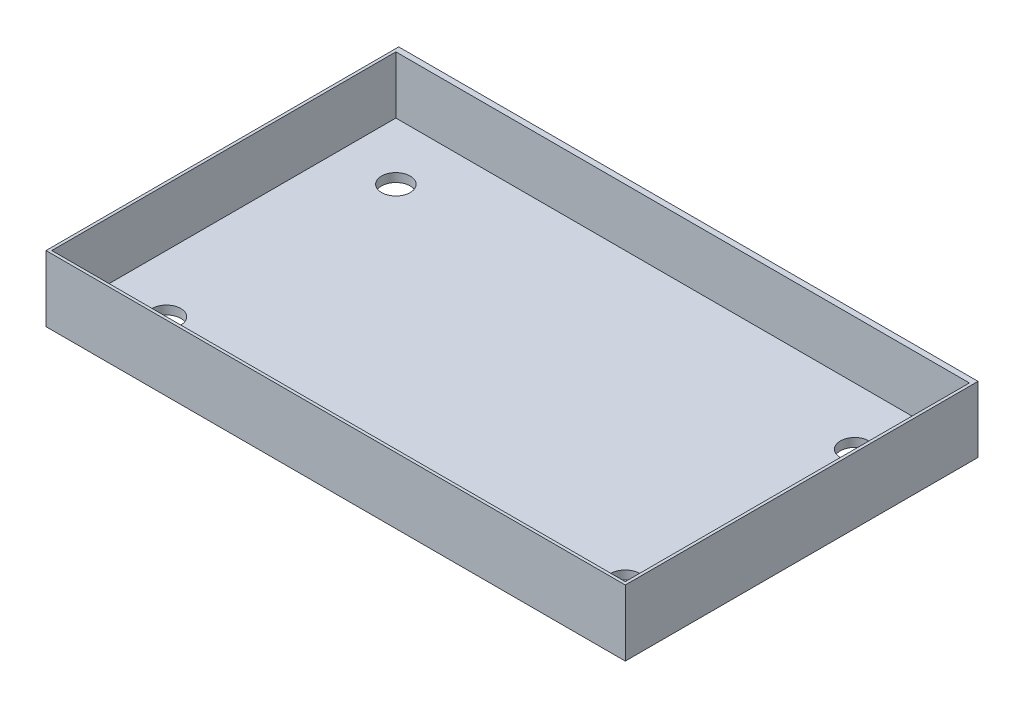
from build123d import *

# Parameters (mm, degrees)
SKETCH1_W             = 200
SKETCH1_H             = 120
BOSS_EXTRUDE3_DEPTH   = 3
SKETCH7_W             = 25
SKETCH7_H             = 120
BOSS_EXTRUDE4_DEPTH   = 1
SKETCH8_W             = 10
SKETCH8_H             = 5
BOSS_EXTRUDE5_DEPTH   = 2
BOSS_EXTRUDE5_2_DEPTH = 2
BOSS_EXTRUDE5_3_DEPTH = 2
BOSS_EXTRUDE5_4_DEPTH = 2
SKETCH10_W            = 10
SKETCH10_H            = 5
BOSS_EXTRUDE6_DEPTH   = 5
SKETCH11_R            = 5
CUT_EXTRUDE4_DEPTH    = 5
SKETCH13_W            = 6
SKETCH13_H            = 2
CUT_EXTRUDE5_DEPTH    = 130.77769454
FILLET3_R             = 1
FILLET4_R             = 1
SKETCH15_W            = 10
SKETCH15_H            = 5
BOSS_EXTRUDE9_DEPTH   = 7
SKETCH16_W            = 6
SKETCH16_H            = 2
CUT_EXTRUDE8_DEPTH    = 138.081180328
FILLET5_R             = 1
SKETCH18_W            = 120
SKETCH18_H            = 23
BOSS_EXTRUDE10_DEPTH  = 1
SKETCH19_W            = 202
SKETCH19_H            = 23
BOSS_EXTRUDE11_DEPTH  = 1
MIRROR2_START         = -62
MIRROR2_OUTLINE_W     = 202
MIRROR2_OUTLINE_H     = 23
MIRROR2_DEPTH         = 1
MIRROR2_START_2       = 60
MIRROR2_2_OUTLINE_W   = 202
MIRROR2_2_OUTLINE_H   = 23
MIRROR2_2_DEPTH       = 1


# Read off the part's stored shape, not the designer's step: Mirror2
with BuildPart() as part:
    # Sketch1 → Boss-Extrude3 (new body)
    with BuildSketch(Plane(origin=(0, 0, 0), x_dir=(1, 0, 0), z_dir=(0, 1, 0))):
        Rectangle(SKETCH1_W, SKETCH1_H)
    extrude(amount=BOSS_EXTRUDE3_DEPTH)

    # Sketch7 → Boss-Extrude4 (add)
    with BuildSketch(Plane(origin=(0, 0, 0), x_dir=(-1, 0, 0), z_dir=(0, -1, 0))):
        Rectangle(SKETCH7_W, SKETCH7_H)
        with Locations((60, 0)):
            Rectangle(SKETCH7_W, SKETCH7_H)
        with Locations((-60, 0)):
            Rectangle(SKETCH7_W, SKETCH7_H)
    extrude(amount=BOSS_EXTRUDE4_DEPTH)



with BuildPart() as body_2:
    # Sketch8 → Boss-Extrude5 (new body)
    with BuildSketch(Plane(origin=(0, -1, 0), x_dir=(-1, 0, 0), z_dir=(0, -1, 0))):
        with Locations((25, -20)):
            Rectangle(SKETCH8_W, SKETCH8_H)
    extrude(amount=-BOSS_EXTRUDE5_DEPTH)


with BuildPart() as body_3:
    # Sketch8 → Boss-Extrude5 2 (new body)
    with BuildSketch(Plane(origin=(0, -1, 0), x_dir=(-1, 0, 0), z_dir=(0, -1, 0))):
        with Locations((-25, -20)):
            Rectangle(SKETCH8_W, SKETCH8_H)
    extrude(amount=-BOSS_EXTRUDE5_2_DEPTH)


with BuildPart() as body_4:
    # Sketch8 → Boss-Extrude5 3 (new body)
    with BuildSketch(Plane(origin=(0, -1, 0), x_dir=(-1, 0, 0), z_dir=(0, -1, 0))):
        with Locations((-25, 20)):
            Rectangle(SKETCH8_W, SKETCH8_H)
    extrude(amount=-BOSS_EXTRUDE5_3_DEPTH)


with BuildPart() as body_5:
    # Sketch8 → Boss-Extrude5 4 (new body)
    with BuildSketch(Plane(origin=(0, -1, 0), x_dir=(-1, 0, 0), z_dir=(0, -1, 0))):
        with Locations((25, 20)):
            Rectangle(SKETCH8_W, SKETCH8_H)
    extrude(amount=-BOSS_EXTRUDE5_4_DEPTH)


with BuildPart() as part_1:
    add(part.part)

    add(body_2.part)  # Boss-Extrude6 merges body 2

    add(body_3.part)  # Boss-Extrude6 merges body 3

    add(body_4.part)  # Boss-Extrude6 merges body 4

    add(body_5.part)  # Boss-Extrude6 merges body 5
    # Sketch10 → Boss-Extrude6 (add)
    with BuildSketch(Plane(origin=(0, -1, 0), x_dir=(-1, 0, 0), z_dir=(0, -1, 0))):
        with Locations((25, -20)):
            Rectangle(SKETCH10_W, SKETCH10_H)
        with Locations((25, 20)):
            Rectangle(SKETCH10_W, SKETCH10_H)
        with Locations((-25, 20)):
            Rectangle(SKETCH10_W, SKETCH10_H)
        with Locations((-25, -20)):
            Rectangle(SKETCH10_W, SKETCH10_H)
    extrude(amount=BOSS_EXTRUDE6_DEPTH)

    # Sketch11 → Cut-Extrude4 (cut)
    with BuildSketch(Plane(origin=(0, 0, 0), x_dir=(-1, 0, 0), z_dir=(0, -1, 0))):
        with Locations(Location((-80, -40, 0), (0, 0, 90))):
            Circle(SKETCH11_R)
        with Locations(Location((-80, 40, 0), (0, 0, 90))):
            Circle(SKETCH11_R)
        with Locations(Location((80, 40, 0), (0, 0, 90))):
            Circle(SKETCH11_R)
        with Locations(Location((80, -40, 0), (0, 0, 90))):
            Circle(SKETCH11_R)
    extrude(amount=-CUT_EXTRUDE4_DEPTH, mode=Mode.SUBTRACT)

    # Sketch13 → Cut-Extrude5 (cut, through all)
    with BuildSketch(Plane(origin=(0, 0, -22.5), x_dir=(-1, 0, 0), z_dir=(0, 0, -1))):
        with Locations((25, -3)):
            Rectangle(SKETCH13_W, SKETCH13_H)
        with Locations((-25, -3)):
            Rectangle(SKETCH13_W, SKETCH13_H)
    extrude(amount=-CUT_EXTRUDE5_DEPTH, mode=Mode.SUBTRACT)

    # Fillet3
    fillet3_edges = [part_1.edges().sort_by_distance(p)[0] for p in [
        (30, 0, -20),
        (25, 0, -17.5),
        (20, 0, -20),
        (25, 0, -22.5),
    ]]
    fillet(fillet3_edges, radius=FILLET3_R)

    # Fillet4
    fillet4_edges = [part_1.edges().sort_by_distance(p)[0] for p in [
        (-25, 0, -22.5),
        (-20, 0, -20),
        (-25, 0, -17.5),
        (-30, 0, -20),
        (-25, 0, 22.5),
        (-30, 0, 20),
        (-25, 0, 17.5),
        (-20, 0, 20),
        (25, 0, 22.5),
        (20, 0, 20),
        (25, 0, 17.5),
        (30, 0, 20),
    ]]
    fillet(fillet4_edges, radius=FILLET4_R)

    # Sketch15 → Boss-Extrude9 (add)
    with BuildSketch(Plane(origin=(0, 0, 0), x_dir=(-1, 0, 0), z_dir=(0, -1, 0))):
        with Locations((-25, 31)):
            Rectangle(SKETCH15_W, SKETCH15_H)
        with Locations((25, 31)):
            Rectangle(SKETCH15_W, SKETCH15_H)
        with Locations((25, -31)):
            Rectangle(SKETCH15_W, SKETCH15_H)
        with Locations((-25, -31)):
            Rectangle(SKETCH15_W, SKETCH15_H)
    extrude(amount=BOSS_EXTRUDE9_DEPTH)

    # Sketch16 → Cut-Extrude8 (cut, through all)
    with BuildSketch(Plane.XY.offset(33.5)):
        with Locations((25, -3)):
            Rectangle(SKETCH16_W, SKETCH16_H)
        with Locations((-25, -3)):
            Rectangle(SKETCH16_W, SKETCH16_H)
    extrude(amount=-CUT_EXTRUDE8_DEPTH, mode=Mode.SUBTRACT)

    # Fillet5
    fillet5_edges = [part_1.edges().sort_by_distance(p)[0] for p in [
        (30, 0, -31),
        (25, 0, -28.5),
        (20, 0, -31),
        (25, 0, -33.5),
        (-20, 0, -31),
        (-25, 0, -28.5),
        (-30, 0, -31),
        (-25, 0, -33.5),
        (-25, 0, 28.5),
        (-20, 0, 31),
        (-25, 0, 33.5),
        (-30, 0, 31),
        (20, 0, 31),
        (25, 0, 28.5),
        (30, 0, 31),
        (25, 0, 33.5),
    ]]
    fillet(fillet5_edges, radius=FILLET5_R)

    # Sketch18 → Boss-Extrude10 (add)
    with BuildSketch(Plane(origin=(100, 0, 0), x_dir=(0, 0, -1), z_dir=(1, 0, 0))):
        with Locations((0, 11.5)):
            Rectangle(SKETCH18_W, SKETCH18_H)
    boss_extrude10 = extrude(amount=BOSS_EXTRUDE10_DEPTH)

    # Mirror1: Boss-Extrude10 across plane
    add(boss_extrude10.mirror(Plane(origin=(0, 0, 0), x_dir=(0, 0, 1), z_dir=(1, 0, 0))))

    # Sketch19 → Boss-Extrude11 (add)
    with BuildSketch(Plane(origin=(0, 0, -60), x_dir=(-1, 0, 0), z_dir=(0, 0, -1))):
        with Locations((0, 11.5)):
            Rectangle(SKETCH19_W, SKETCH19_H)
    extrude(amount=BOSS_EXTRUDE11_DEPTH)

    # Mirror2 outline → Mirror2 (add)
    with BuildSketch(Plane.XY.offset(MIRROR2_START)):
        with Locations((0, 11.5)):
            Rectangle(MIRROR2_OUTLINE_W, MIRROR2_OUTLINE_H)
    extrude(amount=MIRROR2_DEPTH)

    # Mirror2 2 outline → Mirror2 2 (add)
    with BuildSketch(Plane.XY.offset(MIRROR2_START_2)):
        with Locations((0, 11.5)):
            Rectangle(MIRROR2_2_OUTLINE_W, MIRROR2_2_OUTLINE_H)
    extrude(amount=MIRROR2_2_DEPTH)


solid = part_1.part
